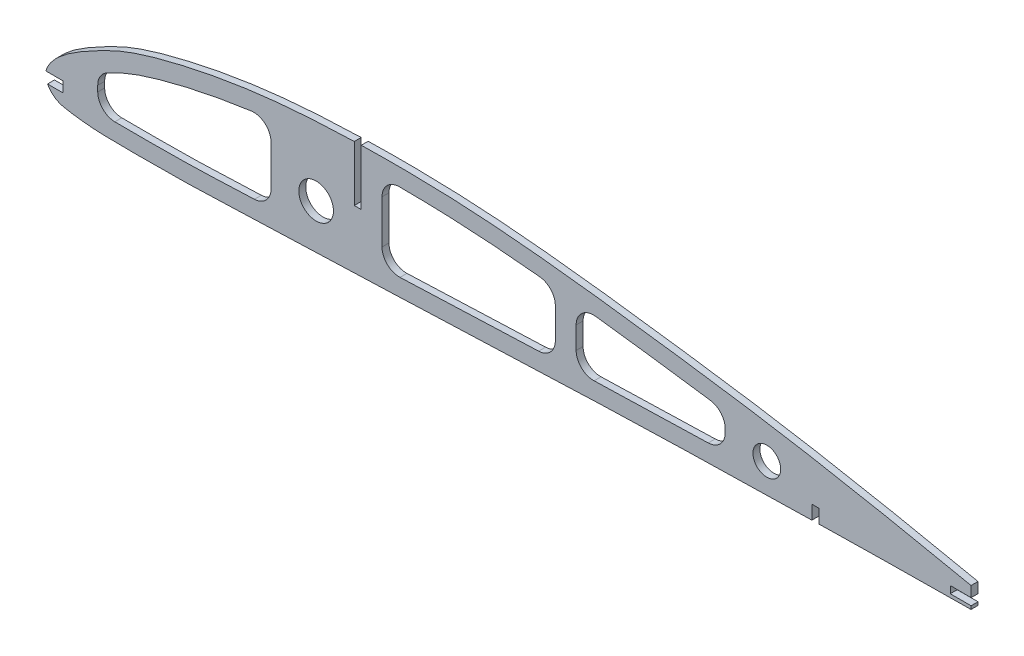
from build123d import *

# Parameters (mm, degrees)
SKETCH_1_R          = 5
SKETCH_1_R_2        = 4
EXTRUDE_1_DEPTH     = 2
CUT_EXTRUDE_2_DEPTH = 2


# Read off the part's stored shape, not the designer's step: 切除-拉伸2
with BuildPart() as part:
    # 草图1 → 凸台-拉伸1 (new body)
    with BuildSketch(Plane.XY):
        with BuildLine():
            Line((90, 12.3715), (90, 28.372426217))
            add(Edge.make_bspline(
                [(90, 28.372426217), (89.259446982, 28.350928743), (82.363996343, 28.13322439), (72.403347361, 27.586524792), (60.185862052, 26.226268085), (51.080991088, 24.79810862), (42.033943524, 23.000087944), (34.581994337, 21.174922903), (28.697351661, 19.44563851), (24.361981086, 17.983441115), (20.174828998, 16.207949367), (16.078941989, 14.139912989), (12.040296713, 11.946766626), (8.14011433, 9.56039573), (5.153679337, 7.316395724), (3.100060439, 5.200618052), (1.813825976, 3.470730924), (1.237398467, 2.180506339), (1.085380705, 1.529058937), (1.078882286, 1.5)],
                knots=[0.345773533, 0.345773533, 0.345773533, 0.345773533, 0.349398211, 0.379527288, 0.394591827, 0.409656366, 0.424720905, 0.439785444, 0.447317713, 0.454849983, 0.462382252, 0.469914522, 0.477446791, 0.484979061, 0.49251133, 0.496277465, 0.5000436, 0.503809734, 0.503985678, 0.503985678, 0.503985678, 0.503985678], degree=3))
            Line((1.078882286, 1.5), (6, 1.5))
            Line((6, 1.5), (6, -1.5))
            Line((6, -1.5), (1.522379628, -1.5))
            add(Edge.make_bspline(
                [(1.522379628, -1.5), (1.617903461, -1.678770523), (2.068186491, -2.42442122), (3.143139608, -3.601090845), (4.854253, -4.619355756), (6.927567017, -5.105597911), (9.209034621, -5.454839075), (12.219971865, -5.84289763), (16.020132359, -6.14266222), (20.609524976, -6.2611368), (25.231457517, -6.286948592), (31.397380169, -6.280305851), (39.107274969, -6.240736398), (48.336813051, -6.022096429), (57.579935967, -5.612990736), (66.840654471, -5.242934226), (76.096556555, -4.921715721), (88.435998513, -4.515955408), (103.853120896, -3.973102953), (122.354625015, -3.248110744), (140.857835973, -2.495489966), (159.368527813, -1.804089638), (177.884173919, -1.222493213), (196.4033921, -0.774877257), (211.106034353, -0.46143934), (219.638958118, -0.28014938), (222, -0.231405833)],
                knots=[0.510182255, 0.510182255, 0.510182255, 0.510182255, 0.511342004, 0.515108139, 0.518874273, 0.522640408, 0.526406543, 0.530172677, 0.537704947, 0.545237216, 0.552769486, 0.560301755, 0.575366294, 0.590430833, 0.605495372, 0.620559911, 0.63562445, 0.650688989, 0.680818067, 0.710947144, 0.741076222, 0.7712053, 0.801334378, 0.831463456, 0.861592533, 0.873117312, 0.873117312, 0.873117312, 0.873117312], degree=3))
            Line((222, -0.231405833), (222, 3.768284765))
            Line((222, 3.768284765), (224, 3.768284765))
            Line((224, 3.768284765), (224, -0.190486213))
            add(Edge.make_bspline(
                [(224, -0.190486213), (227.14486696, -0.126773539), (236.463303784, 0.052517956), (251.961175933, 0.256656825), (270.471854229, 0.429163033), (282.824771355, 0.587434741), (289, 0.610062865)],
                knots=[0.8763714, 0.8763714, 0.8763714, 0.8763714, 0.891721611, 0.921850689, 0.951979767, 0.982108845, 0.982108845, 0.982108845, 0.982108845], degree=3))
            Line((289, 0.610062865), (289, 1.816246039))
            add(Edge.make_bspline(
                [(289, 1.816246039), (276.957314444, 4.502285023), (258.861554155, 8.397620333), (234.648247971, 13.152786595), (216.448478593, 16.478914183), (198.182873559, 19.371550405), (179.850571346, 21.924148488), (161.503162682, 24.358614825), (143.127892269, 26.473190985), (124.712239059, 28.043780086), (107.661076739, 28.627794226), (96.749283398, 28.541845307), (92, 28.425883181)],
                knots=[0.017978355, 0.017978355, 0.017978355, 0.017978355, 0.07823651, 0.108365588, 0.138494666, 0.168623744, 0.198752821, 0.228881899, 0.259010977, 0.289140055, 0.319269133, 0.342510787, 0.342510787, 0.342510787, 0.342510787], degree=3))
            Line((92, 28.425883181), (92, 12.3715))
            Line((92, 12.3715), (90, 12.3715))
        make_face()
        with Locations((79, 8)):
            Circle(SKETCH_1_R, mode=Mode.SUBTRACT)
        with Locations((209, 8)):
            Circle(SKETCH_1_R_2, mode=Mode.SUBTRACT)
    extrude(amount=EXTRUDE_1_DEPTH)

    # 切除-拉伸2 outline → 切除-拉伸2 (cut)
    with BuildSketch(Plane.XY):
        with BuildLine():
            ThreePointArc((197, 10.112022474), (195.77958016, 13.385365385), (192.714090476, 15.060767244))
            add(Edge.make_bspline(
                [(192.714090476, 15.060767244), (191.944613201, 15.171800732), (191.174825659, 15.282099728), (186.308954619, 15.974755997), (182.203786583, 16.539615577), (173.988030512, 17.653320176), (169.883033971, 18.199812389), (163.72254432, 18.989569369), (161.665308348, 19.2482867), (159.608604404, 19.500505924)],
                knots=[0.488248297, 0.488248297, 0.488248297, 0.488248297, 0.5, 0.5, 0.5625, 0.5625, 0.625, 0.625, 0.656347088, 0.656347088, 0.656347088, 0.656347088], degree=3))
            ThreePointArc((159.608604404, 19.500505924), (155.686619703, 18.282214891), (154, 14.537684078))
            Line((154, 14.537684078), (154, 8.170617563))
            ThreePointArc((154, 8.170617563), (155.525809704, 4.574786396), (159.172000715, 3.173576864))
            add(Edge.make_bspline(
                [(159.172000715, 3.173576864), (161.473677828, 3.252801775), (163.775686209, 3.329549926), (170.732455506, 3.552774746), (175.388689917, 3.690754395), (184.07020031, 3.924521784), (188.094738333, 4.024115619), (192.117455336, 4.118639618)],
                knots=[0.71908585, 0.71908585, 0.71908585, 0.71908585, 0.75, 0.75, 0.8125, 0.8125, 0.866546799, 0.866546799, 0.866546799, 0.866546799], degree=3))
            ThreePointArc((192.117455336, 4.118639618), (195.576819584, 5.623499462), (197, 9.117259852))
            Line((197, 9.117259852), (197, 10.112022474))
        make_face()
        with BuildLine():
            ThreePointArc((98, 6.014495108), (99.530624101, 2.414018629), (103.18537235, 1.01793258))
            add(Edge.make_bspline(
                [(103.18537235, 1.01793258), (105.560867454, 1.106063391), (107.936437779, 1.195881883), (119.590927656, 1.6441911), (128.873439493, 2.026235766), (139.842898274, 2.458620096), (141.517508233, 2.523944638), (143.192405577, 2.588444329)],
                knots=[0.467989967, 0.467989967, 0.467989967, 0.467989967, 0.5, 0.5, 0.625, 0.625, 0.647515554, 0.647515554, 0.647515554, 0.647515554], degree=3))
            ThreePointArc((143.192405577, 2.588444329), (146.602917421, 4.117900034), (148, 7.584740967))
            Line((148, 7.584740967), (148, 16.344040065))
            ThreePointArc((148, 16.344040065), (146.709868743, 19.696184738), (143.505250436, 21.318446763))
            add(Edge.make_bspline(
                [(143.505250436, 21.318446763), (142.733269268, 21.396856882), (141.961371617, 21.473825477), (137.095631637, 21.949495859), (133.006687672, 22.305846232), (124.838758232, 22.891937538), (120.76027081, 23.118394336), (112.589349819, 23.431909041), (108.50024347, 23.520641418), (103.942207816, 23.54715361), (103.476725809, 23.549024612), (103.011200556, 23.550067443)],
                knots=[0.738217106, 0.738217106, 0.738217106, 0.738217106, 0.75, 0.75, 0.8125, 0.8125, 0.875, 0.875, 0.9375, 0.9375, 0.944607852, 0.944607852, 0.944607852, 0.944607852], degree=3))
            ThreePointArc((103.011200556, 23.550067443), (99.468428309, 22.089571673), (98, 18.550079988))
            Line((98, 18.550079988), (98, 6.014495108))
        make_face()
        with BuildLine():
            ThreePointArc((66, 16.175207171), (64.287676463, 19.942325894), (60.32352661, 21.129234195))
            add(Edge.make_bspline(
                [(60.32352661, 21.129234195), (59.143282742, 20.968071656), (57.964431768, 20.796736398), (53.109249428, 20.046773379), (49.445857595, 19.384253181), (42.158673028, 17.868714577), (38.533379611, 17.019586343), (33.148990447, 15.546220745), (31.362942012, 15.022439399), (27.821005995, 13.880218625), (26.067238608, 13.253271835), (22.635818059, 11.812670552), (20.957942753, 11.004847704), (19.099592195, 10.049689097), (18.896441621, 9.944700093), (18.693547477, 9.839213217)],
                knots=[0.029920383, 0.029920383, 0.029920383, 0.029920383, 0.033494004, 0.033494004, 0.044658672, 0.044658672, 0.05582334, 0.05582334, 0.061405674, 0.061405674, 0.066988008, 0.066988008, 0.072570342, 0.072570342, 0.073256353, 0.073256353, 0.073256353, 0.073256353], degree=3))
            ThreePointArc((18.693547477, 9.839213217), (16.726110517, 7.997937304), (16, 5.402967421))
            Line((16, 5.402967421), (16, 3.749572283))
            ThreePointArc((16, 3.749572283), (17.43862744, 0.240067263), (20.926650195, -1.249889668))
            add(Edge.make_bspline(
                [(20.926650195, -1.249889668), (21.774172276, -1.262324122), (22.628944162, -1.270076322), (24.631357544, -1.281688823), (25.78455057, -1.283642157), (29.246278981, -1.283863887), (31.564498991, -1.277624199), (36.178821914, -1.249716978), (38.477208261, -1.225805817), (43.065916773, -1.143353772), (45.357830447, -1.085798853), (49.942071524, -0.935363079), (52.243600435, -0.841029597), (56.765262425, -0.649905427), (58.983967724, -0.555595534), (61.201389308, -0.466209999)],
                knots=[0.097664849, 0.097664849, 0.097664849, 0.097664849, 0.109375, 0.109375, 0.125, 0.125, 0.15625, 0.15625, 0.1875, 0.1875, 0.21875, 0.21875, 0.25, 0.25, 0.279748342, 0.279748342, 0.279748342, 0.279748342], degree=3))
            ThreePointArc((61.201389308, -0.466209999), (64.606032899, 1.066132334), (66, 4.529732589))
            Line((66, 4.529732589), (66, 16.175207171))
        make_face()
        with BuildLine():
            Line((261.913052859, 1.349901395), (267.913052859, 1.349901395))
            Line((267.913052859, 1.349901395), (267.913052859, 0.412186808))
            add(Edge.make_bspline(
                [(267.913052859, 0.412186808), (268.766976109, 0.421284301), (275.793854693, 0.497351146), (282.824771355, 0.587434741), (289, 0.610062865)],
                knots=[0.947811677, 0.947811677, 0.947811677, 0.947811677, 0.951979767, 0.982108845, 0.982108845, 0.982108845, 0.982108845], degree=3))
            Line((289, 0.610062865), (289, 1.816246039))
            add(Edge.make_bspline(
                [(289, 1.816246039), (281.978696735, 3.382299906), (274.950202385, 4.918049481), (267.913052859, 6.412186808)],
                knots=[0.017978355, 0.017978355, 0.017978355, 0.017978355, 0.053110949, 0.053110949, 0.053110949, 0.053110949], degree=3))
            Line((267.913052859, 6.412186808), (267.913052859, 3.362186808))
            Line((267.913052859, 3.362186808), (261.913052859, 3.412186808))
            Line((261.913052859, 3.412186808), (261.913052859, 1.349901395))
        make_face()
    extrude(amount=CUT_EXTRUDE_2_DEPTH, mode=Mode.SUBTRACT)


solid = part.part
